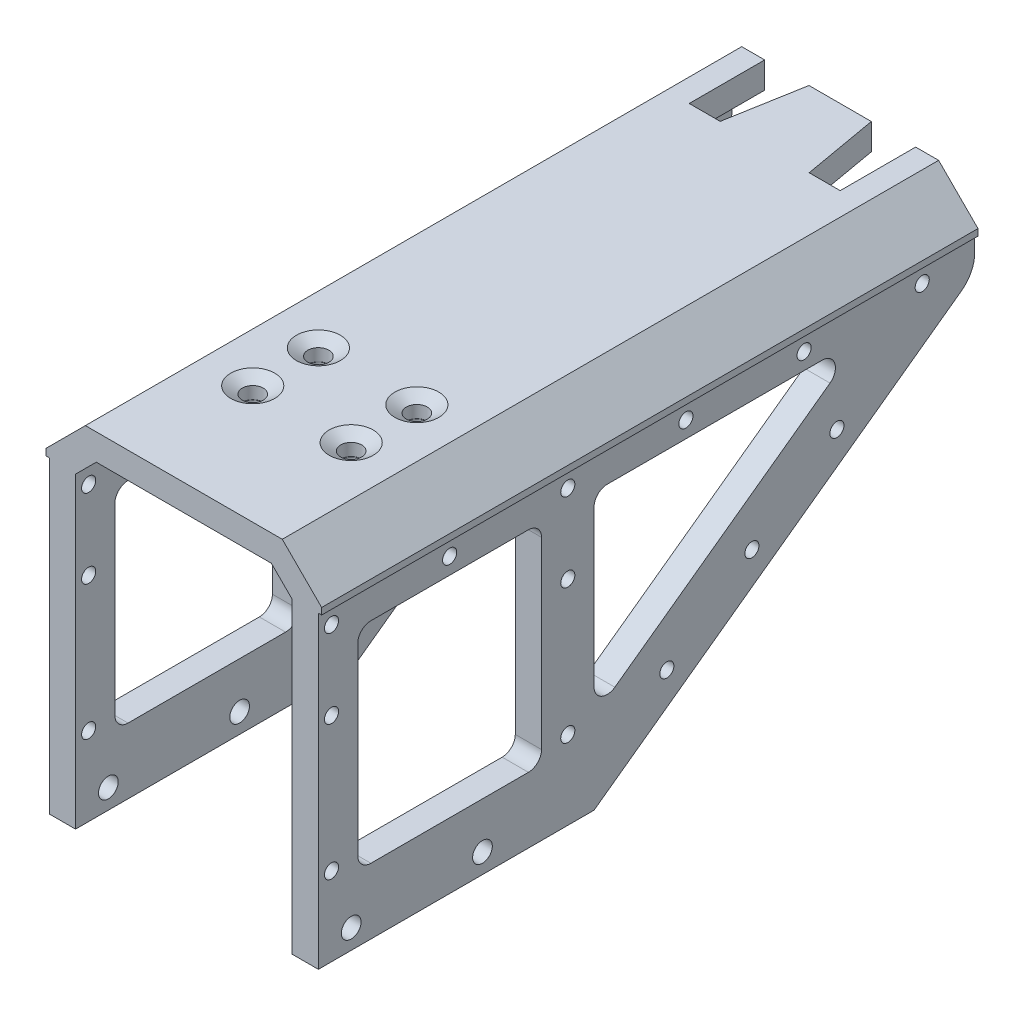
from build123d import *

# Parameters (mm, degrees)
EXTRUDE_1_DEPTH        = 50
SKETCH_3_W             = 28
SKETCH_3_H             = 32
CUT_EXTRUDE_2_DEPTH    = 85.488164852
SKETCH_4_R             = 1.5
SKETCH_4_R_2           = 1.075
CUT_EXTRUDE_3_DEPTH    = 85.488164852
FILLET_1_R             = 2
SKETCH_8_R             = 3.5
SKETCH_8_R_2           = 1.5
EXTRUDE_4_DEPTH        = 4
FILLET_4_R             = 5
CUT_EXTRUDE_5_DEPTH    = 10
SKETCH_12_R            = 1.6
CUT_EXTRUDE_7_DEPTH    = 77.531039455
PATTERN_LINEAR_1_COUNT = 2
PATTERN_LINEAR_1_PITCH = 15


with BuildPart() as part:
    # 草图1 → 凸台-拉伸1 (new, symmetric)
    with BuildSketch(Plane.XY):
        Polygon((-15, 0), (15, 0), (21, -6), (21, -7), (20.5, -7), (20.5, -54), (16.5, -54), (16.5, -7.156854249), (13.343145751, -4), (-13.343145751, -4), (-16.5, -7.156854249), (-16.5, -54), (-20.5, -54), (-20.5, -7), (-21, -7), (-21, -6), align=None)
    extrude(amount=EXTRUDE_1_DEPTH, both=True)

    # 草图3 → 切除-拉伸2 (cut, through all)
    with BuildSketch(Plane(origin=(20.5, 0, 0), x_dir=(0, 0, -1), z_dir=(1, 0, 0))):
        Polygon((-8, -54), (50, -12), (50, -54), align=None)
        with Locations((-30, -28)):
            Rectangle(SKETCH_3_W, SKETCH_3_H)
        Polygon((-8, -41.653438766), (32.949986867, -12), (-8, -12), align=None)
    extrude(amount=-CUT_EXTRUDE_2_DEPTH, mode=Mode.SUBTRACT)

    # 草图4 → 切除-拉伸3 (cut, through all)
    with BuildSketch(Plane(origin=(20.5, 0, 0), x_dir=(0, 0, -1), z_dir=(1, 0, 0))):
        with Locations(Location((-45, -51, 0), (0, 0, 90))):
            Circle(SKETCH_4_R)
        with Locations(Location((-25, -51, 0), (0, 0, 90))):
            Circle(SKETCH_4_R)
        with Locations(Location((-48, -42, 0), (0, 0, 90))):
            Circle(SKETCH_4_R_2)
        with Locations(Location((-48, -21.5, 0), (0, 0, 90))):
            Circle(SKETCH_4_R_2)
        with Locations(Location((-48, -9.5, 0), (0, 0, 90))):
            Circle(SKETCH_4_R_2)
        with Locations(Location((3.091867956, -41.029333193, 0), (0, 0, 90))):
            Circle(SKETCH_4_R_2)
        with Locations(Location((-30, -9.5, 0), (0, 0, 90))):
            Circle(SKETCH_4_R_2)
        with Locations(Location((-12, -9.5, 0), (0, 0, 90))):
            Circle(SKETCH_4_R_2)
        with Locations(Location((6, -9.5, 0), (0, 0, 90))):
            Circle(SKETCH_4_R_2)
        with Locations(Location((24, -9.5, 0), (0, 0, 90))):
            Circle(SKETCH_4_R_2)
        with Locations(Location((42, -9.5, 0), (0, 0, 90))):
            Circle(SKETCH_4_R_2)
        with Locations(Location((-12, -21.5, 0), (0, 0, 90))):
            Circle(SKETCH_4_R_2)
        with Locations(Location((-12, -42, 0), (0, 0, 90))):
            Circle(SKETCH_4_R_2)
        with Locations(Location((16.0509419, -31.645176199, 0), (0, 0, 90))):
            Circle(SKETCH_4_R_2)
        with Locations(Location((29.010015845, -22.261019205, 0), (0, 0, 90))):
            Circle(SKETCH_4_R_2)
    extrude(amount=-CUT_EXTRUDE_3_DEPTH, mode=Mode.SUBTRACT)

    # 圆角1
    fillet_1_edges = [part.edges().sort_by_distance(p)[0] for p in [
        (-18.5, -41.653438766, 8),
        (18.5, -41.653438766, 8),
        (-18.5, -12, 8),
        (18.5, -12, 8),
        (-18.5, -12, -32.949986867),
        (18.5, -12, -32.949986867),
        (-18.5, -44, 44),
        (18.5, -44, 44),
        (-18.5, -12, 44),
        (18.5, -12, 44),
        (-18.5, -12, 16),
        (18.5, -12, 16),
        (-18.5, -44, 16),
        (18.5, -44, 16),
    ]]
    fillet(fillet_1_edges, radius=FILLET_1_R)

    # 草图8 → 凸台-拉伸4 (add)
    # profile 1 of 4: a face of its own
    with BuildSketch(Plane(origin=(20.5, 0, 0), x_dir=(0, 0, -1), z_dir=(1, 0, 0))):
        with Locations((-12, -21.5)):
            Circle(SKETCH_8_R)
        with Locations((-12, -21.5)):
            Circle(SKETCH_8_R_2, mode=Mode.SUBTRACT)
    # profile 2 of 4: a face of its own
    with BuildSketch(Plane(origin=(20.5, 0, 0), x_dir=(0, 0, -1), z_dir=(1, 0, 0))):
        with Locations((-12, -42)):
            Circle(SKETCH_8_R)
        with Locations((-12, -42)):
            Circle(SKETCH_8_R_2, mode=Mode.SUBTRACT)
    # profile 3 of 4: a face of its own
    with BuildSketch(Plane(origin=(20.5, 0, 0), x_dir=(0, 0, -1), z_dir=(1, 0, 0))):
        with BuildLine():
            Line((-50, -18.627718677), (-50, -24.372281323))
            ThreePointArc((-50, -24.372281323), (-44.5, -21.5), (-50, -18.627718677))
        make_face()
        with Locations((-48, -21.5)):
            Circle(SKETCH_8_R_2, mode=Mode.SUBTRACT)
    # profile 4 of 4: a face of its own
    with BuildSketch(Plane(origin=(20.5, 0, 0), x_dir=(0, 0, -1), z_dir=(1, 0, 0))):
        with BuildLine():
            Line((-50, -39.127718677), (-50, -44.872281323))
            ThreePointArc((-50, -44.872281323), (-44.5, -42), (-50, -39.127718677))
        make_face()
        with Locations((-48, -42)):
            Circle(SKETCH_8_R_2, mode=Mode.SUBTRACT)
    extrude_4 = extrude(amount=-EXTRUDE_4_DEPTH)

    # 镜向2: 凸台-拉伸4 across plane
    add(extrude_4.mirror(Plane(origin=(0, 0, 0), x_dir=(0, 0, 1), z_dir=(1, 0, 0))))

    # 圆角4
    fillet_4_edges = [part.edges().sort_by_distance(p)[0] for p in [
        (18.5, -12, -50),
        (-18.5, -12, -50),
    ]]
    fillet(fillet_4_edges, radius=FILLET_4_R)

    # 草图10 → 切除-拉伸5 (cut)
    with BuildSketch(Plane(origin=(0, 0, 0), x_dir=(1, 0, 0), z_dir=(0, 1, 0))):
        Polygon((-4.75, 50), (-6.777760278, 38.5), (-11.5, 38.5), (-11.5, 50), align=None)
        Polygon((11.5, 50), (4.75, 50), (6.777760278, 38.5), (11.5, 38.5), align=None)
    extrude(amount=-CUT_EXTRUDE_5_DEPTH, mode=Mode.SUBTRACT)

    # 草图12 → 切除-拉伸7 (cut, through all)
    with BuildSketch(Plane(origin=(0, 0, 0), x_dir=(1, 0, 0), z_dir=(0, 1, 0))):
        with Locations(Location((-7.5, -32, 0), (0, 0, 270))):
            Circle(SKETCH_12_R)
        with Locations(Location((7.5, -32, 0), (0, 0, 270))):
            Circle(SKETCH_12_R)
        with Locations(Location((7.5, -22, 0), (0, 0, 270))):
            Circle(SKETCH_12_R)
        with Locations(Location((-7.5, -22, 0), (0, 0, 270))):
            Circle(SKETCH_12_R)
    extrude(amount=-CUT_EXTRUDE_7_DEPTH, mode=Mode.SUBTRACT)

    # 切除-放样1: read off the stored shape, not the designer's step
    # 切除-放样1: loft between two sections, ruled curve by curve
    loft_1_from = [
        Edge.make_bspline([(-10.007296258, 0, 19.778296718), (-5.563889695, 0, 14.763704201), (-0.549297178, 0, 19.207110765), (-4.992703742, 0, 24.221703282), (-9.436110305, 0, 29.236295799), (-14.450702822, 0, 24.792889235), (-10.007296258, 0, 19.778296718)], [0, 0, 0, 0, 0.5, 0.5, 0.5, 1, 1, 1, 1], 3, [1, 0.333333333, 0.333333333, 1, 0.333333333, 0.333333333, 1]),
    ]
    loft_1_to = [
        Edge.make_bspline([(-6.853279549, -3, 23.517976501), (-9.889232552, -3, 24.811417403), (-11.182673453, -3, 21.7754644), (-8.146720451, -3, 20.482023499), (-5.110767448, -3, 19.188582597), (-3.817326547, -3, 22.2245356), (-6.853279549, -3, 23.517976501)], [0, 0, 0, 0, 0.5, 0.5, 0.5, 1, 1, 1, 1], 3, [1, 0.333333333, 0.333333333, 1, 0.333333333, 0.333333333, 1]),
    ]
    loft_1 = Solid(Shell([*[Face.make_surface_from_curves(loft_1_from[k], loft_1_to[k]) for k in range(1)], Face(Wire(loft_1_from)), Face(Wire(loft_1_to))]))
    add(loft_1, mode=Mode.SUBTRACT)

    # Loft 1 2: loft between two sections, ruled curve by curve
    loft_1_2_from = [
        Edge.make_bspline([(-10.007296258, 0, 19.778296718), (-5.563889695, 0, 14.763704201), (-0.549297178, 0, 19.207110765), (-4.992703742, 0, 24.221703282), (-9.436110305, 0, 29.236295799), (-14.450702822, 0, 24.792889235), (-10.007296258, 0, 19.778296718)], [0, 0, 0, 0, 0.5, 0.5, 0.5, 1, 1, 1, 1], 3, [1, 0.333333333, 0.333333333, 1, 0.333333333, 0.333333333, 1]),
    ]
    loft_1_2_to = [
        Edge.make_bspline([(-6.853279549, -3, 23.517976501), (-9.889232552, -3, 24.811417403), (-11.182673453, -3, 21.7754644), (-8.146720451, -3, 20.482023499), (-5.110767448, -3, 19.188582597), (-3.817326547, -3, 22.2245356), (-6.853279549, -3, 23.517976501)], [0, 0, 0, 0, 0.5, 0.5, 0.5, 1, 1, 1, 1], 3, [1, 0.333333333, 0.333333333, 1, 0.333333333, 0.333333333, 1]),
    ]
    loft_1_2 = Solid(Shell([*[Face.make_surface_from_curves(loft_1_2_from[k], loft_1_2_to[k]) for k in range(1)], Face(Wire(loft_1_2_from)), Face(Wire(loft_1_2_to))]))
    add(loft_1_2, mode=Mode.SUBTRACT)

    # 阵列(线性)1: 切除-放样1, Loft 1 2 ×2
    with Locations(*[(i * PATTERN_LINEAR_1_PITCH, 0, 0) for i in range(1, PATTERN_LINEAR_1_COUNT)]):
        add(loft_1, mode=Mode.SUBTRACT)
        add(loft_1_2, mode=Mode.SUBTRACT)

    # 阵列(线性)2: read off the stored shape, not the designer's step
    # 阵列(线性)2: loft between two sections, ruled curve by curve
    pattern_linear_2_from = [
        Edge.make_bspline([(-10.007296258, 0, 29.778296718), (-5.563889695, 0, 24.763704201), (-0.549297178, 0, 29.207110765), (-4.992703742, 0, 34.221703282), (-9.436110305, 0, 39.236295799), (-14.450702822, 0, 34.792889235), (-10.007296258, 0, 29.778296718)], [0, 0, 0, 0, 0.5, 0.5, 0.5, 1, 1, 1, 1], 3, [1, 0.333333333, 0.333333333, 1, 0.333333333, 0.333333333, 1]),
    ]
    pattern_linear_2_to = [
        Edge.make_bspline([(-6.853279549, -3, 33.517976501), (-9.889232552, -3, 34.811417403), (-11.182673453, -3, 31.7754644), (-8.146720451, -3, 30.482023499), (-5.110767448, -3, 29.188582597), (-3.817326547, -3, 32.2245356), (-6.853279549, -3, 33.517976501)], [0, 0, 0, 0, 0.5, 0.5, 0.5, 1, 1, 1, 1], 3, [1, 0.333333333, 0.333333333, 1, 0.333333333, 0.333333333, 1]),
    ]
    pattern_linear_2 = Solid(Shell([*[Face.make_surface_from_curves(pattern_linear_2_from[k], pattern_linear_2_to[k]) for k in range(1)], Face(Wire(pattern_linear_2_from)), Face(Wire(pattern_linear_2_to))]))
    add(pattern_linear_2, mode=Mode.SUBTRACT)

    # Pattern Linear 2 2: loft between two sections, ruled curve by curve
    pattern_linear_2_2_from = [
        Edge.make_bspline([(-10.007296258, 0, 29.778296718), (-5.563889695, 0, 24.763704201), (-0.549297178, 0, 29.207110765), (-4.992703742, 0, 34.221703282), (-9.436110305, 0, 39.236295799), (-14.450702822, 0, 34.792889235), (-10.007296258, 0, 29.778296718)], [0, 0, 0, 0, 0.5, 0.5, 0.5, 1, 1, 1, 1], 3, [1, 0.333333333, 0.333333333, 1, 0.333333333, 0.333333333, 1]),
    ]
    pattern_linear_2_2_to = [
        Edge.make_bspline([(-6.853279549, -3, 33.517976501), (-9.889232552, -3, 34.811417403), (-11.182673453, -3, 31.7754644), (-8.146720451, -3, 30.482023499), (-5.110767448, -3, 29.188582597), (-3.817326547, -3, 32.2245356), (-6.853279549, -3, 33.517976501)], [0, 0, 0, 0, 0.5, 0.5, 0.5, 1, 1, 1, 1], 3, [1, 0.333333333, 0.333333333, 1, 0.333333333, 0.333333333, 1]),
    ]
    pattern_linear_2_2 = Solid(Shell([*[Face.make_surface_from_curves(pattern_linear_2_2_from[k], pattern_linear_2_2_to[k]) for k in range(1)], Face(Wire(pattern_linear_2_2_from)), Face(Wire(pattern_linear_2_2_to))]))
    add(pattern_linear_2_2, mode=Mode.SUBTRACT)

    # Pattern Linear 2 3: loft between two sections, ruled curve by curve
    pattern_linear_2_3_from = [
        Edge.make_bspline([(4.992703742, 0, 29.778296718), (9.436110305, 0, 24.763704201), (14.450702822, 0, 29.207110765), (10.007296258, 0, 34.221703282), (5.563889695, 0, 39.236295799), (0.549297178, 0, 34.792889235), (4.992703742, 0, 29.778296718)], [0, 0, 0, 0, 0.5, 0.5, 0.5, 1, 1, 1, 1], 3, [1, 0.333333333, 0.333333333, 1, 0.333333333, 0.333333333, 1]),
    ]
    pattern_linear_2_3_to = [
        Edge.make_bspline([(8.146720451, -3, 33.517976501), (5.110767448, -3, 34.811417403), (3.817326547, -3, 31.7754644), (6.853279549, -3, 30.482023499), (9.889232552, -3, 29.188582597), (11.182673453, -3, 32.2245356), (8.146720451, -3, 33.517976501)], [0, 0, 0, 0, 0.5, 0.5, 0.5, 1, 1, 1, 1], 3, [1, 0.333333333, 0.333333333, 1, 0.333333333, 0.333333333, 1]),
    ]
    pattern_linear_2_3 = Solid(Shell([*[Face.make_surface_from_curves(pattern_linear_2_3_from[k], pattern_linear_2_3_to[k]) for k in range(1)], Face(Wire(pattern_linear_2_3_from)), Face(Wire(pattern_linear_2_3_to))]))
    add(pattern_linear_2_3, mode=Mode.SUBTRACT)

    # Pattern Linear 2 4: loft between two sections, ruled curve by curve
    pattern_linear_2_4_from = [
        Edge.make_bspline([(4.992703742, 0, 29.778296718), (9.436110305, 0, 24.763704201), (14.450702822, 0, 29.207110765), (10.007296258, 0, 34.221703282), (5.563889695, 0, 39.236295799), (0.549297178, 0, 34.792889235), (4.992703742, 0, 29.778296718)], [0, 0, 0, 0, 0.5, 0.5, 0.5, 1, 1, 1, 1], 3, [1, 0.333333333, 0.333333333, 1, 0.333333333, 0.333333333, 1]),
    ]
    pattern_linear_2_4_to = [
        Edge.make_bspline([(8.146720451, -3, 33.517976501), (5.110767448, -3, 34.811417403), (3.817326547, -3, 31.7754644), (6.853279549, -3, 30.482023499), (9.889232552, -3, 29.188582597), (11.182673453, -3, 32.2245356), (8.146720451, -3, 33.517976501)], [0, 0, 0, 0, 0.5, 0.5, 0.5, 1, 1, 1, 1], 3, [1, 0.333333333, 0.333333333, 1, 0.333333333, 0.333333333, 1]),
    ]
    pattern_linear_2_4 = Solid(Shell([*[Face.make_surface_from_curves(pattern_linear_2_4_from[k], pattern_linear_2_4_to[k]) for k in range(1)], Face(Wire(pattern_linear_2_4_from)), Face(Wire(pattern_linear_2_4_to))]))
    add(pattern_linear_2_4, mode=Mode.SUBTRACT)


solid = part.part
